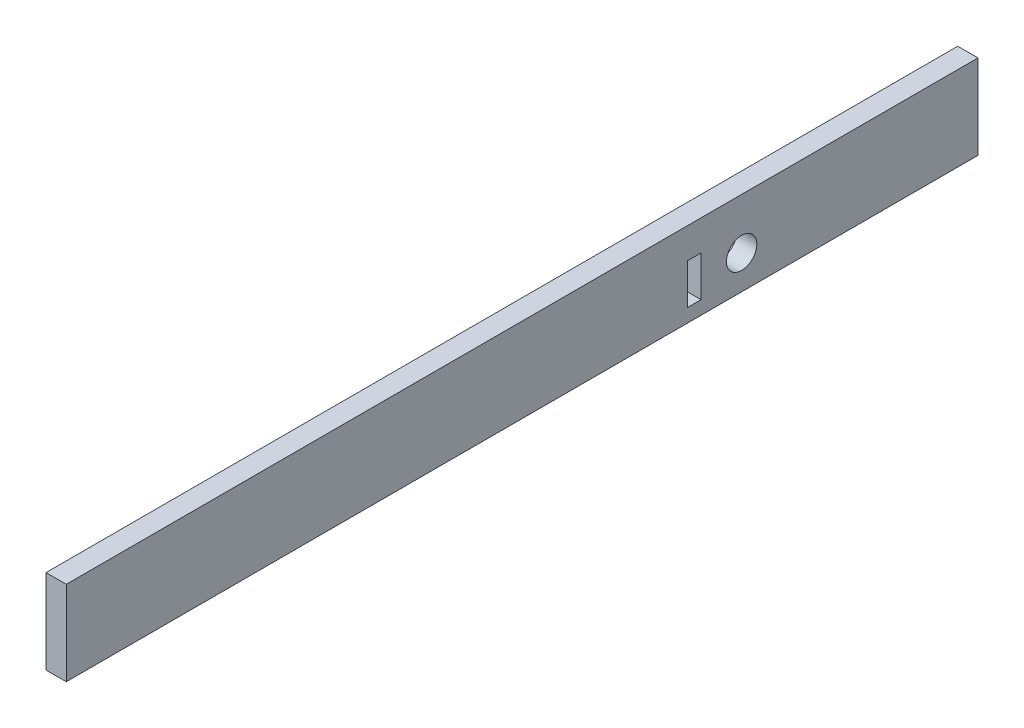
from build123d import *

# Parameters (mm, degrees)
SKETCH1_W           = 270
SKETCH1_H           = 25
SKETCH1_R           = 4.5
SKETCH1_W_2         = 4
SKETCH1_H_2         = 12
BOSS_EXTRUDE1_DEPTH = 6


with BuildPart() as part:
    # Sketch1 → Boss-Extrude1 (new body)
    with BuildSketch(Plane(origin=(0, 0, 0), x_dir=(0, 0, -1), z_dir=(1, 0, 0))):
        with Locations((135, 12.5)):
            Rectangle(SKETCH1_W, SKETCH1_H)
        with Locations((200, 10)):
            Circle(SKETCH1_R, mode=Mode.SUBTRACT)
        with Locations((186, 10)):
            Rectangle(SKETCH1_W_2, SKETCH1_H_2, mode=Mode.SUBTRACT)
    extrude(amount=BOSS_EXTRUDE1_DEPTH)


solid = part.part
